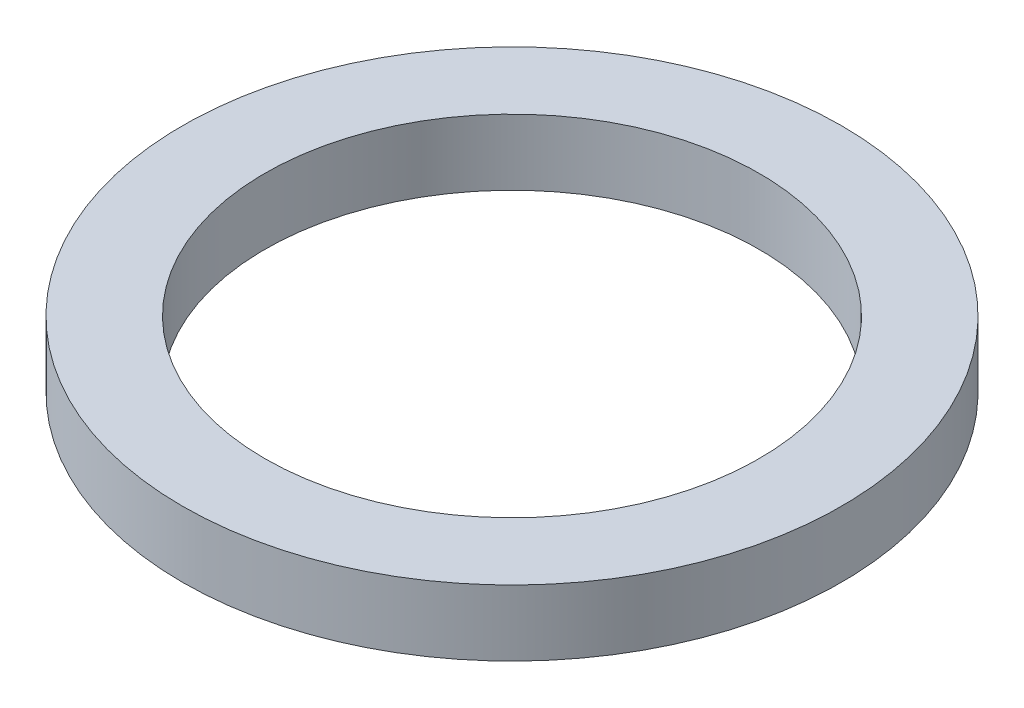
from build123d import *

# Parameters (mm, degrees)
SKETCH1_R           = 50
BOSS_EXTRUDE1_DEPTH = 10
SKETCH2_R           = 37.5
CUT_EXTRUDE1_DEPTH  = 72.414284285


with BuildPart() as part:
    # Sketch1 → Boss-Extrude1 (new body)
    with BuildSketch(Plane(origin=(0, 0, 0), x_dir=(1, 0, 0), z_dir=(0, 1, 0))):
        Circle(SKETCH1_R)
    extrude(amount=BOSS_EXTRUDE1_DEPTH)

    # Sketch2 → Cut-Extrude1 (cut, through all)
    with BuildSketch(Plane(origin=(0, 0, 0), x_dir=(1, 0, 0), z_dir=(0, 1, 0))):
        Circle(SKETCH2_R)
    extrude(amount=CUT_EXTRUDE1_DEPTH, mode=Mode.SUBTRACT)


solid = part.part
